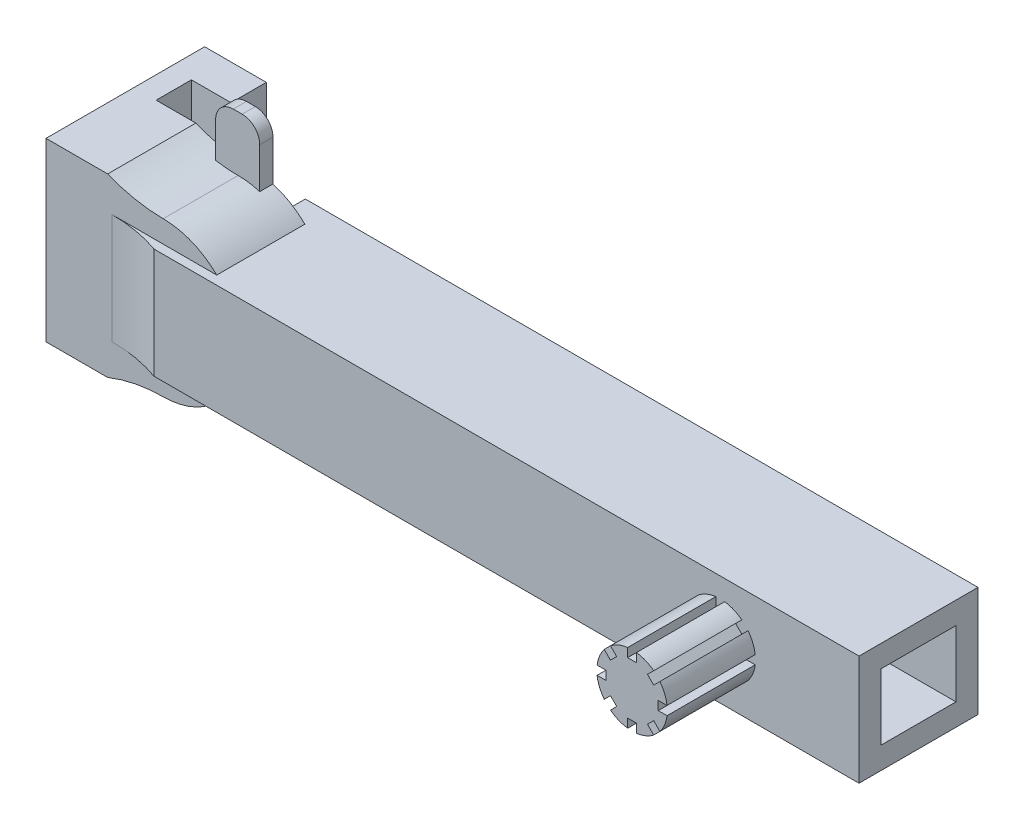
from build123d import *

# Parameters (mm, degrees)
SKETCH3_R                = 15
CUT_EXTRUDE1_DEPTH       = 10
SKETCH4_W                = 17
SKETCH4_H                = 15
CUT_EXTRUDE2_DEPTH       = 32.819805153
SKETCH4_4_W              = 27
SKETCH4_4_H              = 25
SKETCH4_4_W_2            = 17
SKETCH4_4_H_2            = 15
EXTRUDE_THIN2_DEPTH      = 160
SKETCH5_W                = 10
SKETCH5_H                = 60
BOSS_EXTRUDE1_DEPTH      = 3
FILLET1_R                = 4
BOSS_EXTRUDE5_DEPTH      = 9
BOSS_EXTRUDE5_DEPTH_BACK = 5
SKETCH6_W                = 36
SKETCH6_H                = 40
CUT_EXTRUDE4_DEPTH       = 17
CUT_EXTRUDE4_DEPTH_BACK  = 160
SKETCH2_3_R              = 14.5
CUT_EXTRUDE5_DEPTH       = 170.068033643
CUT_EXTRUDE5_DEPTH_BACK  = 170.068033643
SKETCH8_W                = 9
SKETCH8_H                = 8
FILLET2_R                = 34
FILLET3_R                = 34
BOSS_EXTRUDE6_DEPTH      = 20


with BuildPart() as part:
    # Extrude-Thin1: read off the stored shape, not the designer's step
    # Extrude-Thin1 outline → Extrude-Thin1 (revolve)
    with BuildSketch(Plane.XZ):
        Polygon((17.5, 20), (0, 20), (0, 17), (14.5, 17), (14.5, 3), (0, 3), (0, 0), (17.5, 0), align=None)
    revolve(axis=Axis((0, 0, 0), (0, 0, 1)))

    # Sketch3 → Cut-Extrude1 (cut)
    with BuildSketch(Plane(origin=(0, 0, 0), x_dir=(-1, 0, 0), z_dir=(0, 0, -1))):
        Circle(SKETCH3_R)
    extrude(amount=-CUT_EXTRUDE1_DEPTH, mode=Mode.SUBTRACT)

    # Sketch4 → Cut-Extrude2 (cut, through all)
    with BuildSketch(Plane(origin=(0, 0, 0), x_dir=(0, 0, -1), z_dir=(1, 0, 0))):
        with Locations((-8.5, 0)):
            Rectangle(SKETCH4_W, SKETCH4_H)
    extrude(amount=CUT_EXTRUDE2_DEPTH, mode=Mode.SUBTRACT)

    # Sketch4<4> → Extrude-Thin2 (add)
    with BuildSketch(Plane(origin=(0, 0, 0), x_dir=(0, 0, -1), z_dir=(1, 0, 0))):
        with Locations((-8.5, 0)):
            Rectangle(SKETCH4_4_W, SKETCH4_4_H)
        with Locations((-8.5, 0)):
            Rectangle(SKETCH4_4_W_2, SKETCH4_4_H_2, mode=Mode.SUBTRACT)
    extrude(amount=EXTRUDE_THIN2_DEPTH)

    # Sketch5 → Boss-Extrude1 (add)
    with BuildSketch(Plane(origin=(0, 0, 0), x_dir=(-1, 0, 0), z_dir=(0, 0, -1))):
        Rectangle(SKETCH5_W, SKETCH5_H)
    extrude(amount=-BOSS_EXTRUDE1_DEPTH)

    # Fillet1
    fillet1_edges = [part.edges().sort_by_distance(p)[0] for p in [
        (-5, 30, 1.5),
        (5, -30, 1.5),
        (-5, -30, 1.5),
        (5, 30, 1.5),
    ]]
    fillet(fillet1_edges, radius=FILLET1_R)

    # Sketch6 → Boss-Extrude5 (add, two sides: drawn at the far end of the back side and taken through both)
    with BuildSketch(Plane.ZY.offset(17.5).offset(-BOSS_EXTRUDE5_DEPTH_BACK)):
        with Locations((2, 0)):
            Rectangle(SKETCH6_W, SKETCH6_H)
    extrude(amount=BOSS_EXTRUDE5_DEPTH + BOSS_EXTRUDE5_DEPTH_BACK)

    # Sketch2<3> → Cut-Extrude4 (cut, two sides: drawn at the far end of the back side and taken through both)
    with BuildSketch(Plane.XY.offset(-CUT_EXTRUDE4_DEPTH_BACK)):
        with Locations(Location((0, 0, 0), (0, 0, 149.549685979))):
            Circle(SKETCH2_3_R)
    extrude(amount=CUT_EXTRUDE4_DEPTH + CUT_EXTRUDE4_DEPTH_BACK, mode=Mode.SUBTRACT)

    # Sketch8 → Cut-Extrude5 (cut, two sides: drawn at the far end of the back side and taken through both)
    with BuildSketch(Plane.XZ.offset(20).offset(-CUT_EXTRUDE5_DEPTH_BACK)):
        with Locations((-17, -4)):
            Rectangle(SKETCH8_W, SKETCH8_H)
    extrude(amount=CUT_EXTRUDE5_DEPTH + CUT_EXTRUDE5_DEPTH_BACK, mode=Mode.SUBTRACT)

    # Fillet2
    # the kernel refuses this fillet: 34 mm, written as the material it adds along each edge
    with BuildSketch(Plane(origin=(-12.5, -12.247448714, 0), x_dir=(0.923034160497627, -0.3847179987399096, 0), z_dir=(0, 0, 1))) as fillet2_piece_1:
        with BuildLine():
            CenterArc((26.914388587, -31.306789136), FILLET2_R, 112.958457005, 21.780491129)
            Line((2.982546016, -7.155869668), (2.503909164, -6.672851279))
            ThreePointArc((2.503909164, -6.672851279), (0.863609779, -3.839543073), (-0.627663229, -0.261608239))
            Line((-0.627663229, -0.261608239), (0.26524325, 0.626135783))
            ThreePointArc((0.26524325, 0.626135783), (6.826113047, -0.706211474), (13.386982845, 0.626135783))
            Line((13.386982845, 0.626135783), (13.652226095, 0))
        make_face()
    extrude(amount=20)
    with BuildSketch(Plane(origin=(-12.5, 12.247448714, 0), x_dir=(0, 1, 0), z_dir=(0, 0, 1))) as fillet2_piece_2:
        with BuildLine():
            CenterArc((39.251685543, -12.798614811), FILLET2_R, 157.887286265, 21.780491129)
            Line((5.252257101, -12.601471052), (4.572268533, -12.597528177))
            ThreePointArc((4.572268533, -12.597528177), (3.277985866, -6.029043261), (-0.475900864, -0.485714286))
            Line((-0.475900864, -0.485714286), (0, 0.68))
            ThreePointArc((0, 0.68), (3.876275643, 0.68), (7.122568601, 0.255972296))
            Line((7.122568601, 0.255972296), (7.752551286, 0))
        make_face()
    extrude(amount=20)

    # Fillet3
    # the kernel refuses this fillet: 34 mm, written as the material it adds along each edge
    with BuildSketch(Plane(origin=(0, 12.5, 20), x_dir=(-1, 0, 0), z_dir=(0, -1, 0))) as fillet3_piece_1:
        with BuildLine():
            CenterArc((11.489125293, -34), FILLET3_R, 90, 19.749922796)
            Line((0, -2), (0, 0))
            Line((0, 0), (11.489125293, 0))
        make_face()
    extrude(amount=25)

    # Sketch9 → Boss-Extrude6 (add)
    with BuildSketch(Plane.XY.offset(22)):
        with BuildLine():
            Line((136.437253933, 1), (134.437253933, 1))
            Line((134.437253933, 1), (134.437253933, -1))
            Line((134.437253933, -1), (136.437253933, -1))
            ThreePointArc((136.437253933, -1), (135.89103626, -3.061467459), (134.819592861, -4.905379299))
            Line((134.819592861, -4.905379299), (133.405379299, -3.491165737))
            Line((133.405379299, -3.491165737), (131.991165737, -4.905379299))
            Line((131.991165737, -4.905379299), (133.405379299, -6.319592861))
            ThreePointArc((133.405379299, -6.319592861), (131.561467459, -7.39103626), (129.5, -7.937253933))
            Line((129.5, -7.937253933), (129.5, -5.937253933))
            Line((129.5, -5.937253933), (127.5, -5.937253933))
            Line((127.5, -5.937253933), (127.5, -7.937253933))
            ThreePointArc((127.5, -7.937253933), (125.438532541, -7.39103626), (123.594620701, -6.319592861))
            Line((123.594620701, -6.319592861), (125.008834263, -4.905379299))
            Line((125.008834263, -4.905379299), (123.594620701, -3.491165737))
            Line((123.594620701, -3.491165737), (122.180407139, -4.905379299))
            ThreePointArc((122.180407139, -4.905379299), (121.10896374, -3.061467459), (120.562746067, -1))
            Line((120.562746067, -1), (122.562746067, -1))
            Line((122.562746067, -1), (122.562746067, 1))
            Line((122.562746067, 1), (120.562746067, 1))
            ThreePointArc((120.562746067, 1), (121.10896374, 3.061467459), (122.180407139, 4.905379299))
            Line((122.180407139, 4.905379299), (123.594620701, 3.491165737))
            Line((123.594620701, 3.491165737), (125.008834263, 4.905379299))
            Line((125.008834263, 4.905379299), (123.594620701, 6.319592861))
            ThreePointArc((123.594620701, 6.319592861), (125.438532541, 7.39103626), (127.5, 7.937253933))
            Line((127.5, 7.937253933), (127.5, 5.937253933))
            Line((127.5, 5.937253933), (129.5, 5.937253933))
            Line((129.5, 5.937253933), (129.5, 7.937253933))
            ThreePointArc((129.5, 7.937253933), (131.561467459, 7.39103626), (133.405379299, 6.319592861))
            Line((133.405379299, 6.319592861), (131.991165737, 4.905379299))
            Line((131.991165737, 4.905379299), (133.405379299, 3.491165737))
            Line((133.405379299, 3.491165737), (134.819592861, 4.905379299))
            ThreePointArc((134.819592861, 4.905379299), (135.89103626, 3.061467459), (136.437253933, 1))
        make_face()
    extrude(amount=BOSS_EXTRUDE6_DEPTH)


solid = part.part
